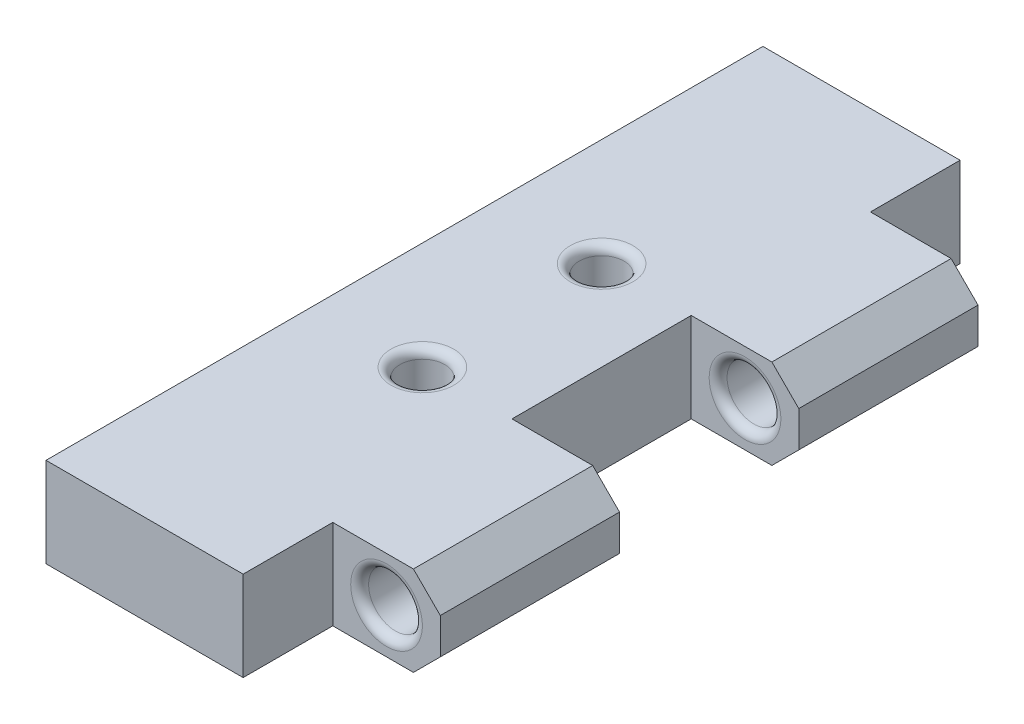
from build123d import *

# Parameters (mm, degrees)
SKETCH1_W             = 12
SKETCH1_H             = 40
SKETCH1_R             = 1.25
HINGE_DEPTH           = 5
SKETCH2_W             = 10
SKETCH2_H             = 5
HINGE_EXTRUDE_1_DEPTH = 5
SKETCH14_W            = 10
SKETCH14_H            = 5
SKETCH14_W_2          = 5
CUT_AWAY_DEPTH        = 1
HOLE_CUT_1_DEPTH      = 38.027017163
HOLE_CUT_1_DEPTH_BACK = 38.027017163
SKETCH3_R             = 1.5
FILLET_HOLES_1_R      = 0.5
CHAMFER_1_SIZE        = 1.5


with BuildPart() as part:
    # Sketch1 → Hinge (new body)
    with BuildSketch(Plane(origin=(0, 0, 0), x_dir=(1, 0, 0), z_dir=(0, 1, 0))):
        Rectangle(SKETCH1_W, SKETCH1_H)
        with Locations((0, 5)):
            Circle(SKETCH1_R, mode=Mode.SUBTRACT)
        with Locations((0, -5)):
            Circle(SKETCH1_R, mode=Mode.SUBTRACT)
    extrude(amount=HINGE_DEPTH)

    # Sketch2 → Hinge Extrude 1 (add)
    with BuildSketch(Plane(origin=(6, 0, 0), x_dir=(0, 0, -1), z_dir=(1, 0, 0))):
        with Locations((-10, 2.5)):
            Rectangle(SKETCH2_W, SKETCH2_H)
        with Locations((10, 2.5)):
            Rectangle(SKETCH2_W, SKETCH2_H)
    extrude(amount=HINGE_EXTRUDE_1_DEPTH)

    # Sketch14 → Cut Away (cut)
    with BuildSketch(Plane(origin=(6, 0, 0), x_dir=(0, 0, -1), z_dir=(1, 0, 0))):
        with Locations((0, 2.5)):
            Rectangle(SKETCH14_W, SKETCH14_H)
        with Locations((-17.5, 2.5)):
            Rectangle(SKETCH14_W_2, SKETCH14_H)
        with Locations((17.5, 2.5)):
            Rectangle(SKETCH14_W_2, SKETCH14_H)
    extrude(amount=-CUT_AWAY_DEPTH, mode=Mode.SUBTRACT)

    # Sketch3 → Hole Cut 1 (cut, two sides: drawn at the far end of the back side and taken through both)
    with BuildSketch(Plane(origin=(0, 0, -15), x_dir=(-1, 0, 0), z_dir=(0, 0, -1)).offset(-HOLE_CUT_1_DEPTH_BACK)):
        with Locations((-8, 2.5)):
            Circle(SKETCH3_R)
    extrude(amount=HOLE_CUT_1_DEPTH + HOLE_CUT_1_DEPTH_BACK, mode=Mode.SUBTRACT)

    # Fillet Holes 1
    fillet_holes_1_edges = [part.edges().sort_by_distance(p)[0] for p in [
        (9.5, 2.5, -15),
        (9.5, 2.5, -5),
        (9.5, 2.5, 5),
        (9.5, 2.5, 15),
        (-1.25, 0, 5),
        (-1.25, 5, 5),
        (-1.25, 0, -5),
        (-1.25, 5, -5),
    ]]
    fillet(fillet_holes_1_edges, radius=FILLET_HOLES_1_R)

    # Chamfer 1
    chamfer_1_edges = [part.edges().sort_by_distance(p)[0] for p in [
        (11, 5, -10),
        (11, 0, -10),
        (11, 0, 10),
        (11, 5, 10),
    ]]
    chamfer(chamfer_1_edges, length=CHAMFER_1_SIZE)


solid = part.part
